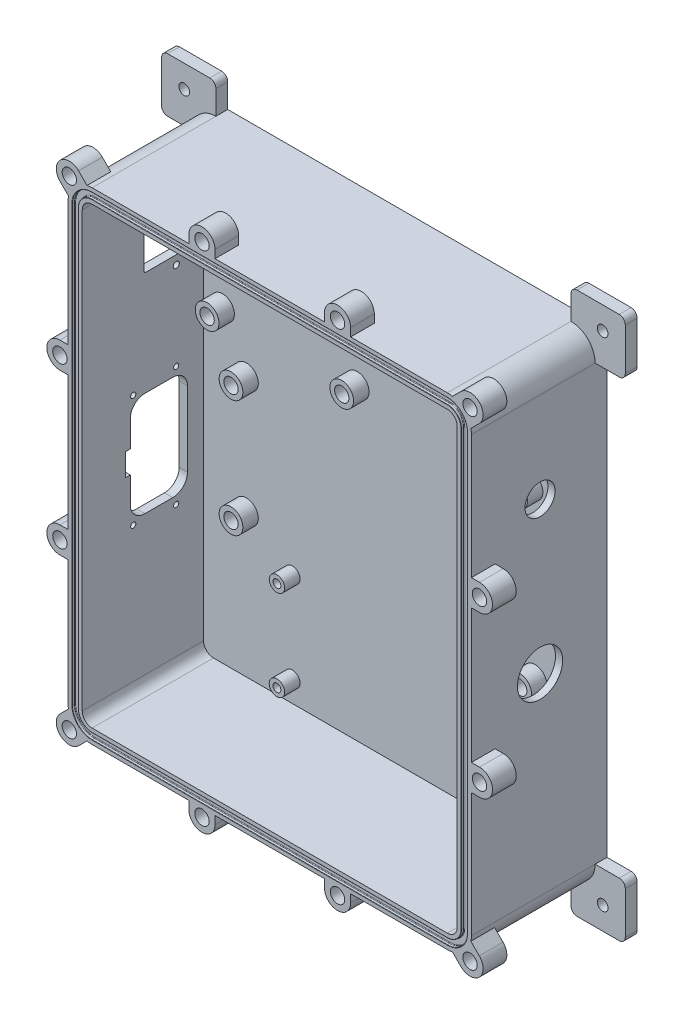
from build123d import *

# Parameters (mm, degrees)
SKETCH1_W                = 170
SKETCH1_H                = 203.2
BOSS_EXTRUDE1_DEPTH      = 57.15
FILLET1_R                = 10.16
SHELL1_T                 = -6
CUT_EXTRUDE8_DEPTH       = 1.2446
FILLET3_R                = 0.254
FILLET4_R                = 0.127
BOSS_EXTRUDE8_DEPTH      = 10
SKETCH22_R               = 3.025
CUT_EXTRUDE9_DEPTH       = 8
MIRROR4_COPY_1_DEPTH     = 10
MIRROR4_COPY_2_SKETCH_R  = 3.025
MIRROR4_COPY_2_DEPTH     = 8
BOSS_EXTRUDE3_DEPTH      = 10
CUT_EXTRUDE2_START       = -8
SKETCH4_6_R              = 3.025
CUT_EXTRUDE2_DEPTH       = 162.084645939
BOSS_EXTRUDE5_DEPTH      = 10
SKETCH12_3_R             = 3.025
CUT_EXTRUDE3_DEPTH       = 8
CUT_EXTRUDE6_DEPTH       = 6
SKETCH15_R               = 1.277999708
SKETCH15_R_2             = 1.27800008
SKETCH15_R_3             = 1.085
CUT_EXTRUDE7_DEPTH       = 6
SKETCH16_W               = 22.86
SKETCH16_H               = 22.86
BOSS_EXTRUDE7_DEPTH      = 5
FILLET2_R                = 2.54
M4_CLEARANCE_HOLE1_D     = 4.5
M4_CLEARANCE_HOLE1_DEPTH = 5
MIRROR6_OUTLINE_R        = 2.25
MIRROR6_DEPTH            = 5
MIRROR7_OUTLINE_R        = 2.25
MIRROR7_DEPTH            = 5
SKETCH23_R               = 5
SKETCH23_R_2             = 3.025
SKETCH23_R_3             = 3.25
SKETCH23_R_4             = 1.665
BOSS_EXTRUDE9_DEPTH      = 6.5
SKETCH24_R               = 6.35
CUT_EXTRUDE10_DEPTH      = 6
SKETCH25_R               = 14.2875
SKETCH25_R_2             = 11.43
CUT_EXTRUDE11_DEPTH      = 3
CUT_EXTRUDE12_DEPTH      = 2.5


with BuildPart() as part:
    # Sketch1 → Boss-Extrude1 (new body)
    with BuildSketch(Plane.XY):
        Rectangle(SKETCH1_W, SKETCH1_H)
    extrude(amount=BOSS_EXTRUDE1_DEPTH)

    # Fillet1
    fillet1_edges = [part.edges().sort_by_distance(p)[0] for p in [
        (85, -101.6, 28.575),
        (-85, -101.6, 28.575),
        (-85, 101.6, 28.575),
        (85, 101.6, 28.575),
    ]]
    fillet(fillet1_edges, radius=FILLET1_R)

    # Shell1
    shell1_openings = [part.faces().sort_by_distance(p)[0] for p in [
        (0, 0, 57.15),
    ]]
    offset(amount=SHELL1_T, openings=shell1_openings, kind=Kind.INTERSECTION)

    # Sketch19 → Cut-Extrude8 (cut)
    with BuildSketch(Plane.XY.offset(57.15)):
        with BuildLine():
            Line((-74.84, -99.8827), (74.84, -99.8827))
            ThreePointArc((74.84, -99.8827), (80.809890422, -97.409890422), (83.2827, -91.44))
            Line((83.2827, -91.44), (83.2827, 91.44))
            ThreePointArc((83.2827, 91.44), (80.809890422, 97.409890422), (74.84, 99.8827))
            Line((74.84, 99.8827), (-74.84, 99.8827))
            ThreePointArc((-74.84, 99.8827), (-80.809890422, 97.409890422), (-83.2827, 91.44))
            Line((-83.2827, 91.44), (-83.2827, -91.44))
            ThreePointArc((-83.2827, -91.44), (-80.809890422, -97.409890422), (-74.84, -99.8827))
        make_face()
        with BuildLine():
            Line((-80.7173, 91.44), (-80.7173, -91.44))
            ThreePointArc((-80.7173, -91.44), (-78.995878685, -95.595878685), (-74.84, -97.3173))
            Line((-74.84, -97.3173), (74.84, -97.3173))
            ThreePointArc((74.84, -97.3173), (78.995878685, -95.595878685), (80.7173, -91.44))
            Line((80.7173, -91.44), (80.7173, 91.44))
            ThreePointArc((80.7173, 91.44), (78.995878685, 95.595878685), (74.84, 97.3173))
            Line((74.84, 97.3173), (-74.84, 97.3173))
            ThreePointArc((-74.84, 97.3173), (-78.995878685, 95.595878685), (-80.7173, 91.44))
        make_face(mode=Mode.SUBTRACT)
    extrude(amount=-CUT_EXTRUDE8_DEPTH, mode=Mode.SUBTRACT)

    # Fillet3
    fillet3_edges = [part.edges().sort_by_distance(p)[0] for p in [
        (-80.809890422, -97.409890422, 55.9054),
        (-83.2827, 0, 55.9054),
        (-80.809890422, 97.409890422, 55.9054),
        (0, 99.8827, 55.9054),
        (80.809890422, 97.409890422, 55.9054),
        (83.2827, 0, 55.9054),
        (80.809890422, -97.409890422, 55.9054),
        (0, -99.8827, 55.9054),
        (0, 97.3173, 55.9054),
        (-78.995878685, 95.595878685, 55.9054),
        (-80.7173, 0, 55.9054),
        (-78.995878685, -95.595878685, 55.9054),
        (0, -97.3173, 55.9054),
        (78.995878685, -95.595878685, 55.9054),
        (80.7173, 0, 55.9054),
        (78.995878685, 95.595878685, 55.9054),
    ]]
    fillet(fillet3_edges, radius=FILLET3_R)

    # Fillet4
    fillet4_edges = [part.edges().sort_by_distance(p)[0] for p in [
        (-80.809890422, -97.409890422, 57.15),
        (0, -99.8827, 57.15),
        (80.809890422, -97.409890422, 57.15),
        (83.2827, 0, 57.15),
        (80.809890422, 97.409890422, 57.15),
        (0, 99.8827, 57.15),
        (-80.809890422, 97.409890422, 57.15),
        (-83.2827, 0, 57.15),
        (-78.995878685, 95.595878685, 57.15),
        (0, 97.3173, 57.15),
        (78.995878685, 95.595878685, 57.15),
        (80.7173, 0, 57.15),
        (78.995878685, -95.595878685, 57.15),
        (0, -97.3173, 57.15),
        (-78.995878685, -95.595878685, 57.15),
        (-80.7173, 0, 57.15),
    ]]
    fillet(fillet4_edges, radius=FILLET4_R)

    # Sketch21 → Boss-Extrude8 (add)
    with BuildSketch(Plane.XY.offset(57.15)):
        with BuildLine():
            ThreePointArc((82.024204897, -98.624204897), (79.705470173, -100.359237636), (76.991425927, -101.36960052))
            Line((76.991425927, -101.36960052), (80.546139592, -104.924314185))
            ThreePointArc((80.546139592, -104.924314185), (88.324314185, -104.924314185), (88.324314185, -97.146139592))
            Line((88.324314185, -97.146139592), (84.76960052, -93.591425927))
            ThreePointArc((84.76960052, -93.591425927), (83.759237636, -96.305470173), (82.024204897, -98.624204897))
        make_face()
    boss_extrude8 = extrude(amount=-BOSS_EXTRUDE8_DEPTH)

    # Sketch22 → Cut-Extrude9 (cut)
    with BuildSketch(Plane.XY.offset(57.15)):
        with Locations((84.435226889, -101.035226889)):
            Circle(SKETCH22_R)
    cut_extrude9 = extrude(amount=-CUT_EXTRUDE9_DEPTH, mode=Mode.SUBTRACT)

    # Mirror3: Boss-Extrude8, Cut-Extrude9 across plane
    add(boss_extrude8.mirror(Plane(origin=(0, 0, 0), x_dir=(0, 0, 1), z_dir=(0, -1, 0))))
    add(cut_extrude9.mirror(Plane(origin=(0, 0, 0), x_dir=(0, 0, 1), z_dir=(0, -1, 0))), mode=Mode.SUBTRACT)

    # Mirror4: Boss-Extrude8, Cut-Extrude9 across plane
    add(boss_extrude8.mirror(Plane.ZY))
    add(cut_extrude9.mirror(Plane.ZY), mode=Mode.SUBTRACT)

    # Mirror4 copy 1 sketch → Mirror4 copy 1 (add)
    with BuildSketch(Plane(origin=(0, 0, 57.15), x_dir=(-1, 0, 0), z_dir=(0, 0, 1))):
        with BuildLine():
            ThreePointArc((82.024204897, -98.624204897), (79.705470173, -100.359237636), (76.991425927, -101.36960052))
            Line((76.991425927, -101.36960052), (80.546139592, -104.924314185))
            ThreePointArc((80.546139592, -104.924314185), (88.324314185, -104.924314185), (88.324314185, -97.146139592))
            Line((88.324314185, -97.146139592), (84.76960052, -93.591425927))
            ThreePointArc((84.76960052, -93.591425927), (83.759237636, -96.305470173), (82.024204897, -98.624204897))
        make_face()
    extrude(amount=-MIRROR4_COPY_1_DEPTH)

    # Mirror4 copy 2 sketch → Mirror4 copy 2 (cut)
    with BuildSketch(Plane(origin=(0, 0, 57.15), x_dir=(-1, 0, 0), z_dir=(0, 0, 1))):
        with Locations((84.435226889, -101.035226889)):
            Circle(MIRROR4_COPY_2_SKETCH_R)
    extrude(amount=-MIRROR4_COPY_2_DEPTH, mode=Mode.SUBTRACT)

    # Sketch4 → Boss-Extrude3 (add)
    with BuildSketch(Plane.XY.offset(57.15)):
        with BuildLine():
            Line((-88.4097, 28.225226889), (-85, 28.225226889))
            Line((-85, 28.225226889), (-85, 33.725226889))
            Line((-85, 33.725226889), (-85, 39.225226889))
            Line((-85, 39.225226889), (-88.4097, 39.225226889))
            ThreePointArc((-88.4097, 39.225226889), (-93.9097, 33.725226889), (-88.4097, 28.225226889))
        make_face()
        with BuildLine():
            Line((-85, -28.225226889), (-88.4097, -28.225226889))
            ThreePointArc((-88.4097, -28.225226889), (-93.9097, -33.725226889), (-88.4097, -39.225226889))
            Line((-88.4097, -39.225226889), (-85, -39.225226889))
            Line((-85, -39.225226889), (-85, -33.725226889))
            Line((-85, -33.725226889), (-85, -28.225226889))
        make_face()
    boss_extrude3 = extrude(amount=-BOSS_EXTRUDE3_DEPTH)

    # Sketch4<6> → Cut-Extrude2 (cut)
    with BuildSketch(Plane.XY.offset(57.15).offset(CUT_EXTRUDE2_START)):
        with Locations(Location((-88.4097, -33.725226889, 0), (0, 0, 180))):
            Circle(SKETCH4_6_R)
        with Locations(Location((-88.4097, 33.725226889, 0), (0, 0, 180))):
            Circle(SKETCH4_6_R)
    cut_extrude2 = extrude(amount=CUT_EXTRUDE2_DEPTH, mode=Mode.SUBTRACT)

    # Mirror5: Boss-Extrude3, Cut-Extrude2 across plane
    add(boss_extrude3.mirror(Plane.ZY))
    add(cut_extrude2.mirror(Plane.ZY), mode=Mode.SUBTRACT)

    # Sketch12 → Boss-Extrude5 (add)
    with BuildSketch(Plane.XY.offset(57.15)):
        with BuildLine():
            Line((-34.055226889, -101.6), (-34.055226889, -105.0097))
            ThreePointArc((-34.055226889, -105.0097), (-28.555226889, -110.5097), (-23.055226889, -105.0097))
            Line((-23.055226889, -105.0097), (-23.055226889, -101.6))
            Line((-23.055226889, -101.6), (-28.555226889, -101.6))
            Line((-28.555226889, -101.6), (-34.055226889, -101.6))
        make_face()
        with BuildLine():
            Line((23.094773111, -101.6), (23.094773111, -105.0097))
            ThreePointArc((23.094773111, -105.0097), (28.594773111, -110.5097), (34.094773111, -105.0097))
            Line((34.094773111, -105.0097), (34.094773111, -101.6))
            Line((34.094773111, -101.6), (28.594773111, -101.6))
            Line((28.594773111, -101.6), (23.094773111, -101.6))
        make_face()
    boss_extrude5 = extrude(amount=-BOSS_EXTRUDE5_DEPTH)

    # Sketch12<3> → Cut-Extrude3 (cut)
    with BuildSketch(Plane.XY.offset(57.15)):
        with Locations((-28.555226889, -105.0097)):
            Circle(SKETCH12_3_R)
        with Locations((28.594773111, -105.0097)):
            Circle(SKETCH12_3_R)
    cut_extrude3 = extrude(amount=-CUT_EXTRUDE3_DEPTH, mode=Mode.SUBTRACT)

    # Mirror2: Boss-Extrude5, Cut-Extrude3 across plane
    add(boss_extrude5.mirror(Plane.ZX))
    add(cut_extrude3.mirror(Plane.ZX), mode=Mode.SUBTRACT)

    # Sketch14 → Cut-Extrude6 (cut)
    with BuildSketch(Plane.ZY.offset(85)):
        with BuildLine():
            Line((13.001198711, 71.173698477), (13.001198711, 55.924178477))
            ThreePointArc((13.001198711, 55.924178477), (13.191649597, 55.464389363), (13.651438711, 55.273938477))
            Line((13.651438711, 55.273938477), (30.400958711, 55.273938477))
            ThreePointArc((30.400958711, 55.273938477), (30.860747824, 55.464389363), (31.051198711, 55.924178477))
            Line((31.051198711, 55.924178477), (31.051198711, 71.173698477))
            ThreePointArc((31.051198711, 71.173698477), (30.860747824, 71.63348759), (30.400958711, 71.823938477))
            Line((30.400958711, 71.823938477), (13.651438711, 71.823938477))
            ThreePointArc((13.651438711, 71.823938477), (13.191649597, 71.63348759), (13.001198711, 71.173698477))
        make_face()
        with BuildLine():
            Line((19.002558116, 11.273530358), (30.710277026, 11.273530358))
            ThreePointArc((30.710277026, 11.273530358), (35.094438064, 9.457551397), (36.910417026, 5.073390358))
            Line((36.910417026, 5.073390358), (36.910417026, -5.924771289))
            Line((36.910417026, -5.924771289), (38.910417196, -5.924771289))
            Line((38.910417196, -5.924771289), (38.910417196, -15.432771289))
            Line((38.910417196, -15.432771289), (36.910417026, -15.432771289))
            Line((36.910417026, -15.432771289), (36.910417026, -26.430980176))
            ThreePointArc((36.910417026, -26.430980176), (35.094438064, -30.815141214), (30.710277026, -32.631120176))
            Line((30.710277026, -32.631120176), (19.002558116, -32.631120176))
            ThreePointArc((19.002558116, -32.631120176), (14.618397078, -30.815141214), (12.802418116, -26.430980176))
            Line((12.802418116, -26.430980176), (12.802418116, 5.073390358))
            ThreePointArc((12.802418116, 5.073390358), (14.618397078, 9.457551397), (19.002558116, 11.273530358))
        make_face()
    extrude(amount=-CUT_EXTRUDE6_DEPTH, mode=Mode.SUBTRACT)

    # Sketch15 → Cut-Extrude7 (cut)
    with BuildSketch(Plane.ZY.offset(85)):
        with Locations(Location((26.526199243, 75.548938622, 0), (0, 0, 270))):
            Circle(SKETCH15_R)
        with Locations(Location((17.526199243, 51.548938622, 0), (0, 0, 270))):
            Circle(SKETCH15_R_2)
        with Locations(Location((35.656417868, 13.021192217, 0), (0, 0, 270))):
            Circle(SKETCH15_R_3)
        with Locations(Location((17.556417868, 14.521192217, 0), (0, 0, 270))):
            Circle(SKETCH15_R_3)
        with Locations(Location((35.656417868, -34.378807783, 0), (0, 0, 270))):
            Circle(SKETCH15_R_3)
        with Locations(Location((17.556417868, -35.878807783, 0), (0, 0, 270))):
            Circle(SKETCH15_R_3)
    extrude(amount=-CUT_EXTRUDE7_DEPTH, mode=Mode.SUBTRACT)

    # Sketch16 → Boss-Extrude7 (add)
    with BuildSketch(Plane(origin=(0, 0, 0), x_dir=(-1, 0, 0), z_dir=(0, 0, -1))):
        with Locations((86.27, -102.87)):
            Rectangle(SKETCH16_W, SKETCH16_H)
    extrude(amount=-BOSS_EXTRUDE7_DEPTH)

    # Fillet2
    fillet2_edges = [part.edges().sort_by_distance(p)[0] for p in [
        (-85, -91.44, 2.5),
        (-74.84, -101.6, 2.5),
        (-74.84, -114.3, 2.5),
        (-97.7, -91.44, 2.5),
        (-97.7, -114.3, 2.5),
    ]]
    fillet(fillet2_edges, radius=FILLET2_R)

    # M4 Clearance Hole1
    with Locations(Plane.XY.offset(5)):
        with Locations((-88.175, -104.775)):
            Hole(M4_CLEARANCE_HOLE1_D / 2, depth=M4_CLEARANCE_HOLE1_DEPTH)

    # Mirror6: read off the stored shape, not the designer's step
    # Mirror6 outline → Mirror6 (add)
    with BuildSketch(Plane.XY):
        with BuildLine():
            Line((95.16, -91.44), (85, -91.44))
            ThreePointArc((85, -91.44), (82.024204897, -98.624204897), (74.84, -101.6))
            Line((74.84, -101.6), (72.3, -101.6))
            ThreePointArc((72.3, -101.6), (74.096051224, -102.343948776), (74.84, -104.14))
            Line((74.84, -104.14), (74.84, -111.76))
            ThreePointArc((74.84, -111.76), (75.583948776, -113.556051224), (77.38, -114.3))
            Line((77.38, -114.3), (95.16, -114.3))
            ThreePointArc((95.16, -114.3), (96.956051224, -113.556051224), (97.7, -111.76))
            Line((97.7, -111.76), (97.7, -93.98))
            ThreePointArc((97.7, -93.98), (96.956051224, -92.183948776), (95.16, -91.44))
        make_face()
        with Locations((88.175, -104.775)):
            Circle(MIRROR6_OUTLINE_R, mode=Mode.SUBTRACT)
    extrude(amount=MIRROR6_DEPTH)

    # Mirror7: read off the stored shape, not the designer's step
    # Mirror7 outline → Mirror7 (add)
    # profile 1 of 2: a face of its own
    with BuildSketch(Plane.XY):
        with BuildLine():
            Line((-74.84, 101.6), (-74.84, 111.76))
            ThreePointArc((-74.84, 111.76), (-75.583948776, 113.556051224), (-77.38, 114.3))
            Line((-77.38, 114.3), (-95.16, 114.3))
            ThreePointArc((-95.16, 114.3), (-96.956051224, 113.556051224), (-97.7, 111.76))
            Line((-97.7, 111.76), (-97.7, 93.98))
            ThreePointArc((-97.7, 93.98), (-96.956051224, 92.183948776), (-95.16, 91.44))
            Line((-95.16, 91.44), (-87.54, 91.44))
            ThreePointArc((-87.54, 91.44), (-85.743948776, 90.696051224), (-85, 88.9))
            Line((-85, 88.9), (-85, 91.44))
            ThreePointArc((-85, 91.44), (-82.024204897, 98.624204897), (-74.84, 101.6))
        make_face()
        with Locations((-88.175, 104.775)):
            Circle(MIRROR7_OUTLINE_R, mode=Mode.SUBTRACT)
    # profile 2 of 2: a face of its own
    with BuildSketch(Plane.XY):
        with BuildLine():
            ThreePointArc((77.38, 114.3), (75.583948776, 113.556051224), (74.84, 111.76))
            Line((74.84, 111.76), (74.84, 101.6))
            ThreePointArc((74.84, 101.6), (82.024204897, 98.624204897), (85, 91.44))
            Line((85, 91.44), (95.16, 91.44))
            ThreePointArc((95.16, 91.44), (96.956051224, 92.183948776), (97.7, 93.98))
            Line((97.7, 93.98), (97.7, 111.76))
            ThreePointArc((97.7, 111.76), (96.956051224, 113.556051224), (95.16, 114.3))
            Line((95.16, 114.3), (77.38, 114.3))
        make_face()
        with Locations((88.175, 104.775)):
            Circle(MIRROR7_OUTLINE_R, mode=Mode.SUBTRACT)
    extrude(amount=MIRROR7_DEPTH)

    # Sketch23 → Boss-Extrude9 (add)
    # profile 1 of 14: a face of its own
    with BuildSketch(Plane.XY.offset(6)):
        with Locations(Location((-71.027809278, 84.244999997, 0), (0, 0, 180))):
            Circle(SKETCH23_R)
        with Locations(Location((-71.027809278, 84.244999997, 0), (0, 0, 180))):
            Circle(SKETCH23_R_2, mode=Mode.SUBTRACT)
    # profile 2 of 14: a face of its own
    with BuildSketch(Plane.XY.offset(6)):
        with Locations(Location((-14.277809278, 84.24499932, 0), (0, 0, 180))):
            Circle(SKETCH23_R)
        with Locations(Location((-14.277809278, 84.24499932, 0), (0, 0, 180))):
            Circle(SKETCH23_R_2, mode=Mode.SUBTRACT)
    # profile 3 of 14: a face of its own
    with BuildSketch(Plane.XY.offset(6)):
        with Locations(Location((58.972190722, 84.244998446, 0), (0, 0, 180))):
            Circle(SKETCH23_R)
        with Locations(Location((58.972190722, 84.244998446, 0), (0, 0, 180))):
            Circle(SKETCH23_R_2, mode=Mode.SUBTRACT)
    # profile 4 of 14: a face of its own
    with BuildSketch(Plane.XY.offset(6)):
        with Locations(Location((-71.027809874, 34.244999997, 0), (0, 0, 180))):
            Circle(SKETCH23_R)
        with Locations(Location((-71.027809874, 34.244999997, 0), (0, 0, 180))):
            Circle(SKETCH23_R_2, mode=Mode.SUBTRACT)
    # profile 5 of 14: a face of its own
    with BuildSketch(Plane.XY.offset(6)):
        with Locations(Location((-14.277809874, 34.24499932, 0), (0, 0, 180))):
            Circle(SKETCH23_R)
        with Locations(Location((-14.277809874, 34.24499932, 0), (0, 0, 180))):
            Circle(SKETCH23_R_2, mode=Mode.SUBTRACT)
    # profile 6 of 14: a face of its own
    with BuildSketch(Plane.XY.offset(6)):
        with Locations(Location((58.972190126, 34.244998446, 0), (0, 0, 180))):
            Circle(SKETCH23_R)
        with Locations(Location((58.972190126, 34.244998446, 0), (0, 0, 180))):
            Circle(SKETCH23_R_2, mode=Mode.SUBTRACT)
    # profile 7 of 14: a face of its own
    with BuildSketch(Plane.XY.offset(6)):
        with Locations(Location((-60.960114583, 14.055264686, 0), (0, 0, 180))):
            Circle(SKETCH23_R)
        with Locations(Location((-60.960114583, 14.055264686, 0), (0, 0, 180))):
            Circle(SKETCH23_R_2, mode=Mode.SUBTRACT)
    # profile 8 of 14: a face of its own
    with BuildSketch(Plane.XY.offset(6)):
        with Locations(Location((-60.96011517, -35.220735314, 0), (0, 0, 180))):
            Circle(SKETCH23_R)
        with Locations(Location((-60.96011517, -35.220735314, 0), (0, 0, 180))):
            Circle(SKETCH23_R_2, mode=Mode.SUBTRACT)
    # profile 9 of 14: a face of its own
    with BuildSketch(Plane.XY.offset(6)):
        with Locations(Location((60.70588483, -35.220736765, 0), (0, 0, 180))):
            Circle(SKETCH23_R)
        with Locations(Location((60.70588483, -35.220736765, 0), (0, 0, 180))):
            Circle(SKETCH23_R_2, mode=Mode.SUBTRACT)
    # profile 10 of 14: a face of its own
    with BuildSketch(Plane.XY.offset(6)):
        with Locations(Location((60.705885417, 14.011263235, 0), (0, 0, 180))):
            Circle(SKETCH23_R)
        with Locations(Location((60.705885417, 14.011263235, 0), (0, 0, 180))):
            Circle(SKETCH23_R_2, mode=Mode.SUBTRACT)
    # profile 11 of 14: a face of its own
    with BuildSketch(Plane.XY.offset(6)):
        with Locations(Location((41.6, -48.6, 0), (0, 0, 180))):
            Circle(SKETCH23_R_3)
        with Locations(Location((41.6, -48.6, 0), (0, 0, 180))):
            Circle(SKETCH23_R_4, mode=Mode.SUBTRACT)
    # profile 12 of 14: a face of its own
    with BuildSketch(Plane.XY.offset(6)):
        with Locations(Location((-41.6, -48.6, 0), (0, 0, 180))):
            Circle(SKETCH23_R_3)
        with Locations(Location((-41.6, -48.6, 0), (0, 0, 180))):
            Circle(SKETCH23_R_4, mode=Mode.SUBTRACT)
    # profile 13 of 14: a face of its own
    with BuildSketch(Plane.XY.offset(6)):
        with Locations(Location((-41.6, -86.6, 0), (0, 0, 180))):
            Circle(SKETCH23_R_3)
        with Locations(Location((-41.6, -86.6, 0), (0, 0, 180))):
            Circle(SKETCH23_R_4, mode=Mode.SUBTRACT)
    # profile 14 of 14: a face of its own
    with BuildSketch(Plane.XY.offset(6)):
        with Locations(Location((41.6, -86.6, 0), (0, 0, 180))):
            Circle(SKETCH23_R_3)
        with Locations(Location((41.6, -86.6, 0), (0, 0, 180))):
            Circle(SKETCH23_R_4, mode=Mode.SUBTRACT)
    extrude(amount=BOSS_EXTRUDE9_DEPTH)

    # Sketch24 → Cut-Extrude10 (cut)
    with BuildSketch(Plane.ZY.offset(-79)):
        with BuildLine():
            ThreePointArc((18.7, -10.16), (28.225, -19.685), (37.75, -10.16))
            Line((37.75, -10.16), (18.7, -10.16))
        make_face()
        with BuildLine():
            Line((18.7, -10.16), (37.75, -10.16))
            ThreePointArc((37.75, -10.16), (28.225, -0.635), (18.7, -10.16))
        make_face()
        with Locations(Location((28.225, 53.34, 0), (0, 0, 270))):
            Circle(SKETCH24_R)
    extrude(amount=-CUT_EXTRUDE10_DEPTH, mode=Mode.SUBTRACT)

    # Sketch25 → Cut-Extrude11 (cut)
    with BuildSketch(Plane.ZY.offset(-79)):
        with Locations(Location((28.225, -10.16, 0), (0, 0, 270))):
            Circle(SKETCH25_R)
        with Locations(Location((28.225, 53.34, 0), (0, 0, 270))):
            Circle(SKETCH25_R_2)
    extrude(amount=-CUT_EXTRUDE11_DEPTH, mode=Mode.SUBTRACT)

    # Sketch26 → Cut-Extrude12 (cut)
    with BuildSketch(Plane.ZY.offset(85)):
        with BuildLine():
            Line((35.968917868, 19.483692217), (13.743917868, 19.483692217))
            ThreePointArc((13.743917868, 19.483692217), (9.253789808, 17.623820277), (7.393917868, 13.133692217))
            Line((7.393917868, 13.133692217), (7.393917868, -34.491307783))
            ThreePointArc((7.393917868, -34.491307783), (9.253789808, -38.981435844), (13.743917868, -40.841307783))
            Line((13.743917868, -40.841307783), (35.968917868, -40.841307783))
            ThreePointArc((35.968917868, -40.841307783), (40.459045929, -38.981435844), (42.318917868, -34.491307783))
            Line((42.318917868, -34.491307783), (42.318917868, 13.133692217))
            ThreePointArc((42.318917868, 13.133692217), (40.459045929, 17.623820277), (35.968917868, 19.483692217))
        make_face()
        with BuildLine():
            Line((28.526198711, 79.548938477), (15.526198711, 79.548938477))
            ThreePointArc((15.526198711, 79.548938477), (11.283558024, 77.791579164), (9.526198711, 73.548938477))
            Line((9.526198711, 73.548938477), (9.526198711, 53.548938477))
            ThreePointArc((9.526198711, 53.548938477), (11.283558024, 49.306297789), (15.526198711, 47.548938477))
            Line((15.526198711, 47.548938477), (28.526198711, 47.548938477))
            ThreePointArc((28.526198711, 47.548938477), (32.768839398, 49.306297789), (34.526198711, 53.548938477))
            Line((34.526198711, 53.548938477), (34.526198711, 73.548938477))
            ThreePointArc((34.526198711, 73.548938477), (32.768839398, 77.791579164), (28.526198711, 79.548938477))
        make_face()
    extrude(amount=-CUT_EXTRUDE12_DEPTH, mode=Mode.SUBTRACT)


solid = part.part
